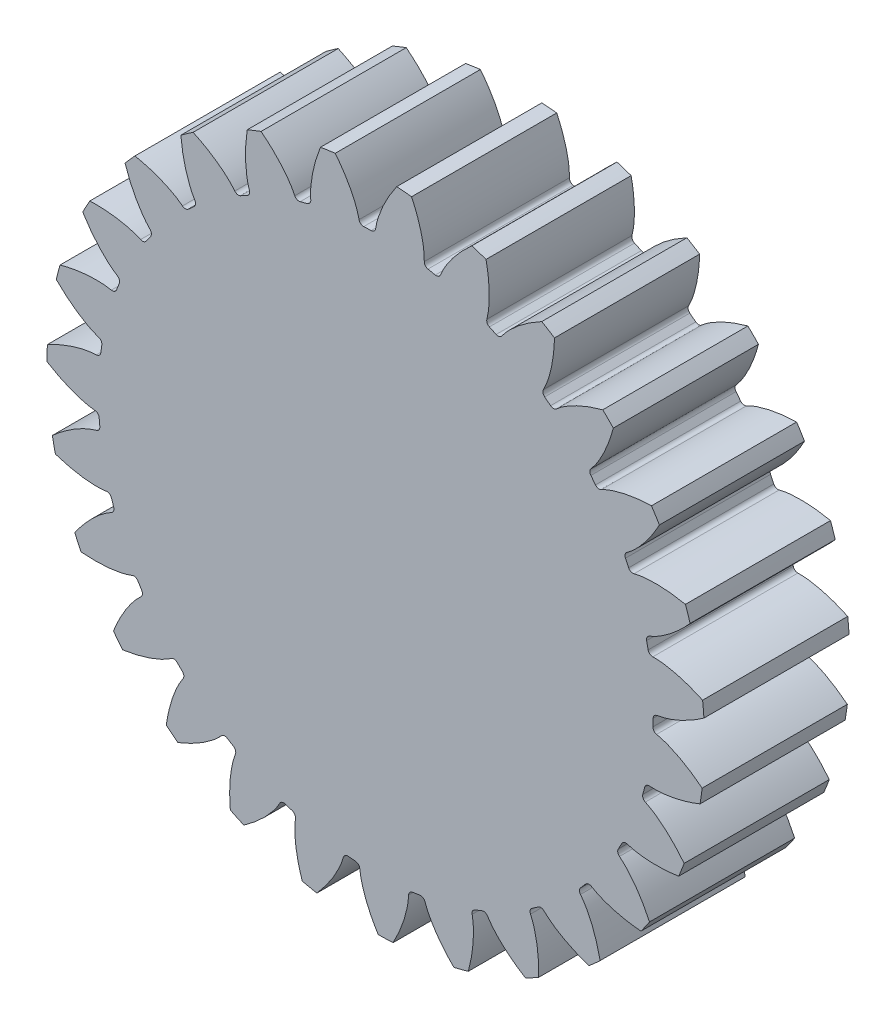
from build123d import *

# Parameters (mm, degrees)
SKETCH2_R                = 18.125
BOSS_EXTRUDE1_DEPTH      = 8
CUT_EXTRUDE1_DEPTH       = 8
FILLET1_R                = 0.254
CIRPATTERN3_COUNT        = 27
FILLET1_OF_CIRPATTERN3_R = 0.254


# Read off the part's stored shape, not the designer's step: Cut-Extrude1
with BuildPart() as part:
    # Sketch2 → Boss-Extrude1 (new body)
    with BuildSketch(Plane.XY):
        Circle(SKETCH2_R)
    extrude(amount=BOSS_EXTRUDE1_DEPTH)

    # Cut-Extrude1 outline → Cut-Extrude1 (cut)
    with BuildSketch(Plane.XY):
        with BuildLine():
            add(Edge.make_bspline(
                [(15.293943906, 0), (15.305253299, 0), (15.336964339, 0.00074082), (15.396845119, 0.005066139), (15.494240284, 0.016267993), (15.617714722, 0.036610689), (15.776289364, 0.069834677), (15.961506744, 0.117828662), (16.163035486, 0.179773153), (16.379749283, 0.256988095), (16.59342961, 0.342624014), (16.803983292, 0.435958219), (17.011216032, 0.536009953), (17.259008351, 0.665439426), (17.551466226, 0.832023435), (17.793413557, 0.984652677), (17.98203981, 1.112094263), (18.081230118, 1.181579697), (18.086216109, 1.185078834)],
                knots=[0, 0, 0, 0, 0, 0.005376748, 0.015083688, 0.02853182, 0.046610139, 0.064854849, 0.092110525, 0.119476175, 0.146842495, 0.174208853, 0.201574955, 0.228941013, 0.256307345, 0.307035032, 0.361767351, 0.364665932, 0.364665932, 0.364665932, 0.364665932, 0.364665932], degree=4))
            Line((15.293943906, 0), (15.269621682, -0.86219134))
            add(Edge.make_bspline(
                [(17.990644834, -2.202799001), (17.985864036, -2.199024345), (17.890748691, -2.124057592), (17.709606894, -1.986184932), (17.476648761, -1.820158714), (17.194047109, -1.637352405), (16.953945405, -1.49415955), (16.752682616, -1.382584249), (16.547725468, -1.277528577), (16.339212659, -1.179982683), (16.127196474, -1.090673365), (15.929480328, -1.017466265), (15.747263149, -0.959107033), (15.590813683, -0.916996286), (15.468682422, -0.889725108), (15.372073647, -0.873050446), (15.312531935, -0.865356246), (15.280913089, -0.862828904), (15.269621682, -0.86219134)],
                knots=[0.544424984, 0.544424984, 0.544424984, 0.544424984, 0.544424984, 0.547323565, 0.602055884, 0.652783571, 0.680149903, 0.707515961, 0.734882063, 0.762248421, 0.789614741, 0.816980391, 0.844236067, 0.862480777, 0.880559096, 0.894007228, 0.903714168, 0.909090916, 0.909090916, 0.909090916, 0.909090916, 0.909090916], degree=4))
            ThreePointArc((17.990644834, -2.202799001), (18.117792441, -0.511098867), (18.086216109, 1.185078834))
        make_face()
    cut_extrude1 = extrude(amount=CUT_EXTRUDE1_DEPTH, mode=Mode.SUBTRACT)

    # Fillet1
    fillet1_edges = [part.edges().sort_by_distance(p)[0] for p in [
        (15.269621682, -0.86219134, 4),
        (15.293943906, 0, 4),
    ]]
    fillet(fillet1_edges, radius=FILLET1_R)

    # CirPattern3: Cut-Extrude1 ×27 about axis
    cirpattern3_axis = Axis((0, 0, 18.908609159), (0, 0, -1))
    for i in range(1, CIRPATTERN3_COUNT):
        add(cut_extrude1.rotate(cirpattern3_axis, i * 360 / CIRPATTERN3_COUNT), mode=Mode.SUBTRACT)

    # Fillet1 of CirPattern3
    fillet1_of_cirpattern3_edges = [part.edges().sort_by_distance(p)[0] for p in [
        (14.659192047, -4.360367961, 4),
        (14.881693669, -3.527026191, 4),
        (13.258481574, -7.623476016, 4),
        (13.667167474, -6.863909487, 4),
        (11.143002927, -10.475600507, 4),
        (11.715840743, -9.830757646, 4),
        (8.426802109, -12.762982662, 4),
        (9.132910004, -12.267627116, 4),
        (5.256310208, -14.362309119, 4),
        (6.057621724, -14.043145632, 4),
        (1.802449263, -15.187359773, 4),
        (2.655765489, -15.061594533, 4),
        (-1.748582189, -15.193655931, 4),
        (-0.889263752, -15.268068974, 4),
        (-5.205347122, -14.380858165, 4),
        (-4.386352553, -14.651437864, 4),
        (-8.381490444, -12.792784613, 4),
        (-7.646971953, -13.244943947, 4),
        (-11.105785447, -10.515048731, 4),
        (-10.495341116, -11.124411673, 4),
        (-13.231364682, -7.67044385, 4),
        (-12.777903722, -8.404159486, 4),
        (-14.643637622, -4.412323356, 4),
        (-14.371606231, -5.230836887, 4),
        (-15.266468268, -0.916333368, 4),
        (-15.190531729, -1.775518517, 4),
        (-15.066279658, 2.629056389, 4),
        (-15.190531729, 1.775518517, 4),
        (-14.053864011, 6.032713036, 4),
        (-14.371606231, 5.230836887, 4),
        (-12.283800918, 9.111144562, 4),
        (-12.777903722, 8.404159486, 4),
        (-9.851514938, 11.698391926, 4),
        (-10.495341116, 11.124411673, 4),
        (-6.888131238, 13.654975953, 4),
        (-7.646971953, 13.244943947, 4),
        (-3.553406599, 14.875416692, 4),
        (-4.386352553, 14.651437864, 4),
        (-0.027116892, 15.293919867, 4),
        (-0.889263752, 15.268068974, 4),
        (3.500634695, 14.887923863, 4),
        (2.655765489, 15.061594533, 4),
        (6.839666159, 13.67931603, 4),
        (6.057621724, 14.043145632, 4),
        (9.80996945, 11.733252729, 4),
        (9.132910004, 12.267627116, 4),
        (12.251414749, 9.154646737, 4),
        (11.715840743, 9.830757646, 4),
        (14.032383107, 6.082511369, 4),
        (13.667167474, 6.863909487, 4),
        (15.05686206, 2.682466239, 4),
        (14.881693669, 3.527026191, 4),
    ]]
    fillet(fillet1_of_cirpattern3_edges, radius=FILLET1_OF_CIRPATTERN3_R)


solid = part.part
